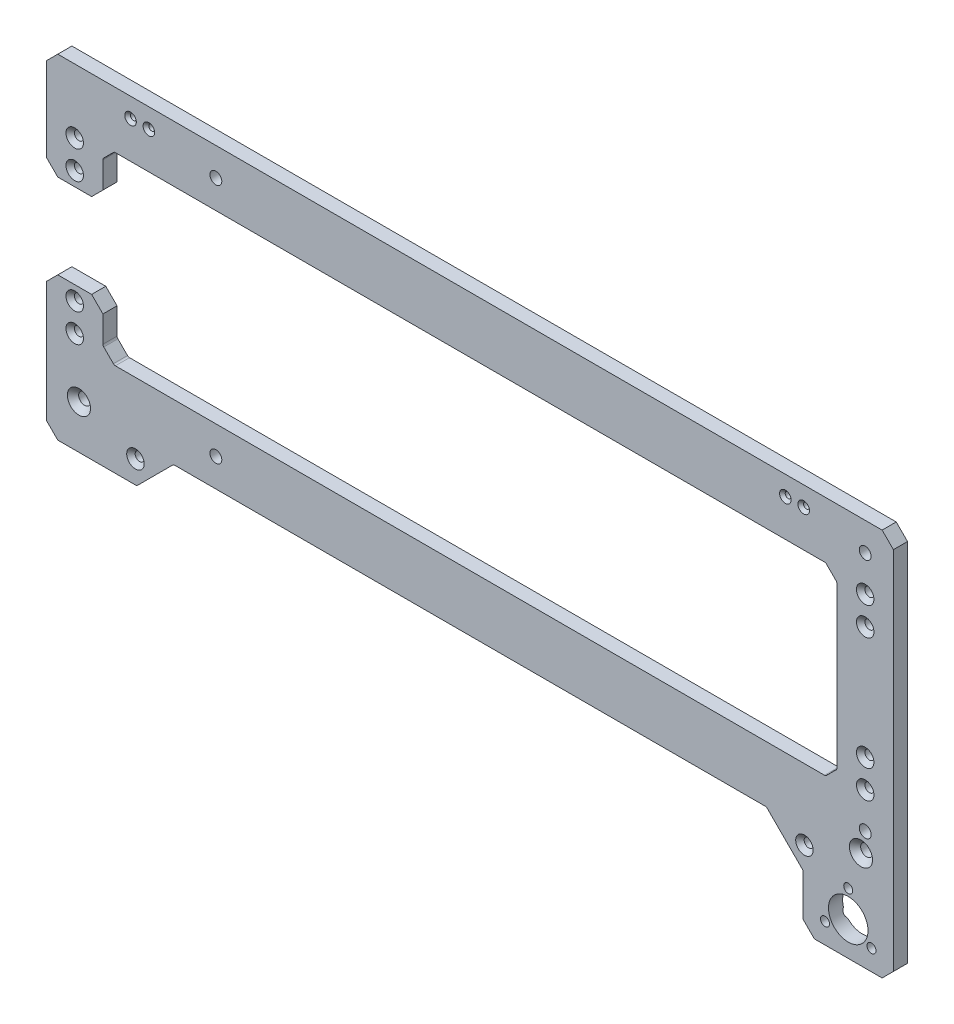
from build123d import *

# Parameters (mm, degrees)
SKETCH_1_W          = 300
SKETCH_1_H          = 105.4
SKETCH_1_W_2        = 260
SKETCH_1_H_2        = 65.4
EXTRUDE_1_DEPTH     = 2.5
SKETCH_2_R          = 2.1
CUT_EXTRUDE_1_DEPTH = 160.066935596
SKETCH_3_R          = 1.6
CUT_EXTRUDE_2_DEPTH = 160.066935596
CHAMFER_1_SIZE      = 1.5
CHAMFER_2_SIZE      = 2
SKETCH_5_W          = 20
SKETCH_5_H          = 30
CUT_EXTRUDE_5_DEPTH = 160.066935596
EXTRUDE_2_DEPTH     = 5
SKETCH_7_R          = 1.6
SKETCH_7_R_2        = 2.1
CUT_EXTRUDE_6_DEPTH = 164.833726687
CHAMFER_4_SIZE      = 2
CHAMFER_5_SIZE      = 1.5
SKETCH_8_W          = 32
SKETCH_8_H          = 19
EXTRUDE_3_DEPTH     = 5
CHAMFER_3_SIZE      = 4
FILLET_1_R          = 1
SKETCH_9_R          = 7
SKETCH_9_R_2        = 1.6
CUT_EXTRUDE_7_DEPTH = 173.334239198
CHAMFER_6_SIZE      = 1.5
SKETCH_10_R         = 1.05
CUT_EXTRUDE_8_DEPTH = 173.334239201
CHAMFER_7_SIZE      = 1


with BuildPart() as part:
    # 草图1 → 凸台-拉伸1 (new, symmetric)
    with BuildSketch(Plane.XY):
        Rectangle(SKETCH_1_W, SKETCH_1_H)
        Rectangle(SKETCH_1_W_2, SKETCH_1_H_2, mode=Mode.SUBTRACT)
    extrude(amount=EXTRUDE_1_DEPTH, both=True)

    # 草图2 → 切除-拉伸1 (cut, through all)
    with BuildSketch(Plane.XY.offset(2.5)):
        with Locations((-90, 42.7)):
            Circle(SKETCH_2_R)
        with Locations((140, 42.7)):
            Circle(SKETCH_2_R)
        with Locations((-90, -42.7)):
            Circle(SKETCH_2_R)
        with Locations((140, -42.7)):
            Circle(SKETCH_2_R)
    extrude(amount=-CUT_EXTRUDE_1_DEPTH, mode=Mode.SUBTRACT)

    # 草图3 → 切除-拉伸2 (cut, through all)
    with BuildSketch(Plane.XY.offset(2.5)):
        with Locations((140, 30)):
            Circle(SKETCH_3_R)
        with Locations((140, -30)):
            Circle(SKETCH_3_R)
        with Locations((140, 20)):
            Circle(SKETCH_3_R)
        with Locations((140, -20)):
            Circle(SKETCH_3_R)
        with Locations(Location((-140, -30, 0), (0, 0, 180))):
            Circle(SKETCH_3_R)
        with Locations(Location((-140, -20, 0), (0, 0, 180))):
            Circle(SKETCH_3_R)
        with Locations(Location((-140, 20, 0), (0, 0, 180))):
            Circle(SKETCH_3_R)
        with Locations(Location((-140, 30, 0), (0, 0, 180))):
            Circle(SKETCH_3_R)
    extrude(amount=-CUT_EXTRUDE_2_DEPTH, mode=Mode.SUBTRACT)

    # 倒角1
    chamfer_1_edges = [part.edges().sort_by_distance(p)[0] for p in [
        (-138.4, -30, 2.5),
        (138.4, -20, 2.5),
        (138.4, 20, 2.5),
        (138.4, -30, 2.5),
        (-138.4, -20, 2.5),
        (-138.4, 20, 2.5),
        (-138.4, 30, 2.5),
        (138.4, 30, 2.5),
    ]]
    chamfer(chamfer_1_edges, length=CHAMFER_1_SIZE)

    # 倒角2
    chamfer_2_edges = [part.edges().sort_by_distance(p)[0] for p in [
        (137.9, 42.7, -2.5),
        (-92.1, -42.7, -2.5),
        (137.9, -42.7, -2.5),
        (-92.1, 42.7, -2.5),
    ]]
    chamfer(chamfer_2_edges, length=CHAMFER_2_SIZE)

    # 草图5 → 切除-拉伸5 (cut, through all)
    with BuildSketch(Plane(origin=(0, 0, -2.5), x_dir=(-1, 0, 0), z_dir=(0, 0, -1))):
        with Locations((140, 0)):
            Rectangle(SKETCH_5_W, SKETCH_5_H)
    extrude(amount=-CUT_EXTRUDE_5_DEPTH, mode=Mode.SUBTRACT)

    # 草图6 → 凸台-拉伸2 (add)
    with BuildSketch(Plane(origin=(0, 0, -2.5), x_dir=(-1, 0, 0), z_dir=(0, 0, -1))):
        Polygon((150, -52.7), (150, -65.7), (118, -65.7), (105, -52.7), align=None)
        Polygon((-118, -65.7), (-105, -52.7), (-150, -52.7), (-150, -65.7), align=None)
    extrude(amount=-EXTRUDE_2_DEPTH)

    # 草图7 → 切除-拉伸6 (cut, through all)
    with BuildSketch(Plane(origin=(0, 0, -2.5), x_dir=(-1, 0, 0), z_dir=(0, 0, -1))):
        with Locations((118.485281374, -57.7)):
            Circle(SKETCH_7_R)
        with Locations((-118.485281374, -57.7)):
            Circle(SKETCH_7_R)
        with Locations((138.5, -50.2)):
            Circle(SKETCH_7_R_2)
        with Locations(Location((-138.5, -50.2, 0), (0, 0, 180))):
            Circle(SKETCH_7_R_2)
    extrude(amount=-CUT_EXTRUDE_6_DEPTH, mode=Mode.SUBTRACT)

    # 倒角4
    chamfer_4_edges = [part.edges().sort_by_distance(p)[0] for p in [
        (136.4, -50.2, 2.5),
        (-136.4, -50.2, 2.5),
    ]]
    chamfer(chamfer_4_edges, length=CHAMFER_4_SIZE)

    # 倒角5
    chamfer_5_edges = [part.edges().sort_by_distance(p)[0] for p in [
        (120.085281374, -57.7, 2.5),
        (-116.885281374, -57.7, 2.5),
    ]]
    chamfer(chamfer_5_edges, length=CHAMFER_5_SIZE)

    # 草图8 → 凸台-拉伸3 (add)
    with BuildSketch(Plane.XY.offset(2.5)):
        with Locations((134, -75.2)):
            Rectangle(SKETCH_8_W, SKETCH_8_H)
    extrude(amount=-EXTRUDE_3_DEPTH)

    # 倒角3
    chamfer_3_edges = [part.edges().sort_by_distance(p)[0] for p in [
        (-130, -15, 0),
        (-130, 15, 0),
        (-150, 15, 0),
        (-150, -15, 0),
        (-150, -65.7, 0),
        (-130, 32.7, 0),
        (-130, -32.7, 0),
        (130, -32.7, 0),
        (130, 32.7, 0),
        (150, -84.7, 0),
        (118, -84.7, 0),
        (-150, 52.7, 0),
        (150, 52.7, 0),
    ]]
    chamfer(chamfer_3_edges, length=CHAMFER_3_SIZE)

    # 圆角1
    fillet_1_edges = [part.edges().sort_by_distance(p)[0] for p in [
        (-105, -52.7, 0),
        (105, -52.7, 0),
        (118, -65.7, 0),
        (-130, 28.7, 0),
        (-130, -28.7, 0),
        (126, -32.7, 0),
        (-126, -32.7, 0),
        (126, 32.7, 0),
        (-126, 32.7, 0),
        (130, -28.7, 0),
        (130, 28.7, 0),
    ]]
    fillet(fillet_1_edges, radius=FILLET_1_R)

    # 草图9 → 切除-拉伸7 (cut, through all)
    with BuildSketch(Plane.XY.offset(2.5)):
        with Locations((134, -72.7)):
            Circle(SKETCH_9_R)
        with Locations((134, -63.2)):
            Circle(SKETCH_9_R_2)
        with Locations((142.227241336, -77.45)):
            Circle(SKETCH_9_R_2)
        with Locations((125.772758664, -77.45)):
            Circle(SKETCH_9_R_2)
    extrude(amount=-CUT_EXTRUDE_7_DEPTH, mode=Mode.SUBTRACT)

    # 倒角6
    # the kernel refuses this chamfer: 1.5 mm, written as the material it takes off along each edge
    with BuildSketch(Plane(origin=(125.772758664, -77.45, -2.5), x_dir=(1, 0, 0), z_dir=(0, -1, 0))) as chamfer_6_piece_1:
        Polygon((1.6, CHAMFER_6_SIZE), (1.6 + CHAMFER_6_SIZE, 0), (1.6, 0), align=None)
    revolve(axis=Axis((125.772758664, -77.45, -2.5), (0, 0, 1)), mode=Mode.SUBTRACT)
    with BuildSketch(Plane(origin=(142.227241336, -77.45, -2.5), x_dir=(1, 0, 0), z_dir=(0, -1, 0))) as chamfer_6_piece_2:
        Polygon((1.6, CHAMFER_6_SIZE), (1.6 + CHAMFER_6_SIZE, 0), (1.6, 0), align=None)
    revolve(axis=Axis((142.227241336, -77.45, -2.5), (0, 0, 1)), mode=Mode.SUBTRACT)
    with BuildSketch(Plane(origin=(134, -63.2, -2.5), x_dir=(1, 0, 0), z_dir=(0, -1, 0))) as chamfer_6_piece_3:
        Polygon((1.6, CHAMFER_6_SIZE), (1.6 + CHAMFER_6_SIZE, 0), (1.6, 0), align=None)
    revolve(axis=Axis((134, -63.2, -2.5), (0, 0, 1)), mode=Mode.SUBTRACT)

    # 草图10 → 切除-拉伸8 (cut, through all)
    with BuildSketch(Plane(origin=(0, 0, -2.5), x_dir=(-1, 0, 0), z_dir=(0, 0, -1))):
        with Locations((120.223206297, 45.8)):
            Circle(SKETCH_10_R)
        with Locations((113.723206297, 45.8)):
            Circle(SKETCH_10_R)
        with Locations(Location((-111.723206297, 45.8, 0), (0, 0, 180))):
            Circle(SKETCH_10_R)
        with Locations(Location((-118.223206297, 45.8, 0), (0, 0, 180))):
            Circle(SKETCH_10_R)
    extrude(amount=-CUT_EXTRUDE_8_DEPTH, mode=Mode.SUBTRACT)

    # 倒角7
    chamfer_7_edges = [part.edges().sort_by_distance(p)[0] for p in [
        (-119.173206297, 45.8, 2.5),
        (-112.673206297, 45.8, 2.5),
        (110.673206297, 45.8, 2.5),
        (117.173206297, 45.8, 2.5),
    ]]
    chamfer(chamfer_7_edges, length=CHAMFER_7_SIZE)


solid = part.part
